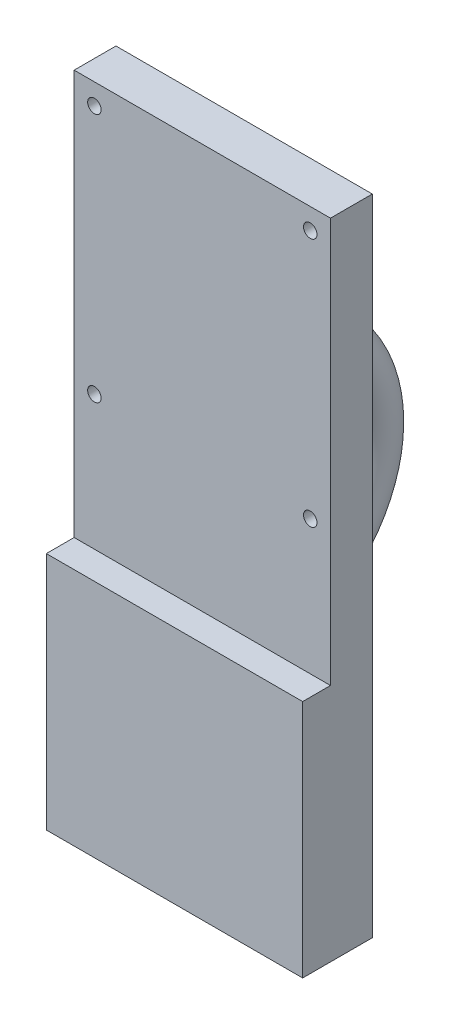
from build123d import *

# Parameters (mm, degrees)
ESQUISSE1_W             = 190
ESQUISSE1_H             = 300
BOSS_EXTRU_1_DEPTH      = 31
ESQUISSE2_R             = 5
ENL_V_MAT_EXTRU_1_DEPTH = 357.456168413
ESQUISSE3_W             = 190
ESQUISSE3_H             = 51.62
BOSS_EXTRU_2_DEPTH      = 177.45
ESQUISSE4_R             = 20
R_VOLUTION1_ANGLE       = 180


with BuildPart() as part:
    # Esquisse1 → Boss.-Extru.1 (new body)
    with BuildSketch(Plane.XY):
        with Locations((95, 150)):
            Rectangle(ESQUISSE1_W, ESQUISSE1_H)
    extrude(amount=BOSS_EXTRU_1_DEPTH)

    # Esquisse2 → Enlèv. mat.-Extru.1 (cut, through all)
    with BuildSketch(Plane(origin=(0, 0, 0), x_dir=(-1, 0, 0), z_dir=(0, 0, -1))):
        with Locations((-175, 284.5)):
            Circle(ESQUISSE2_R)
        with Locations((-15, 284.5)):
            Circle(ESQUISSE2_R)
        with Locations((-175, 99.5)):
            Circle(ESQUISSE2_R)
        with Locations((-15, 99.5)):
            Circle(ESQUISSE2_R)
    extrude(amount=-ENL_V_MAT_EXTRU_1_DEPTH, mode=Mode.SUBTRACT)

    # Esquisse3 → Boss.-Extru.2 (add)
    with BuildSketch(Plane.XZ):
        with Locations((95, 25.81)):
            Rectangle(ESQUISSE3_W, ESQUISSE3_H)
    extrude(amount=BOSS_EXTRU_2_DEPTH)

    # Esquisse4 → Révolution1 (revolve)
    with BuildSketch(Plane(origin=(0, 0, 0), x_dir=(-1, 0, 0), z_dir=(0, 0, -1))):
        with Locations((-95, -28.725)):
            Circle(ESQUISSE4_R)
    revolve(axis=Axis((1095, 61.275, 0), (1, 0, 0)), revolution_arc=R_VOLUTION1_ANGLE)


solid = part.part
